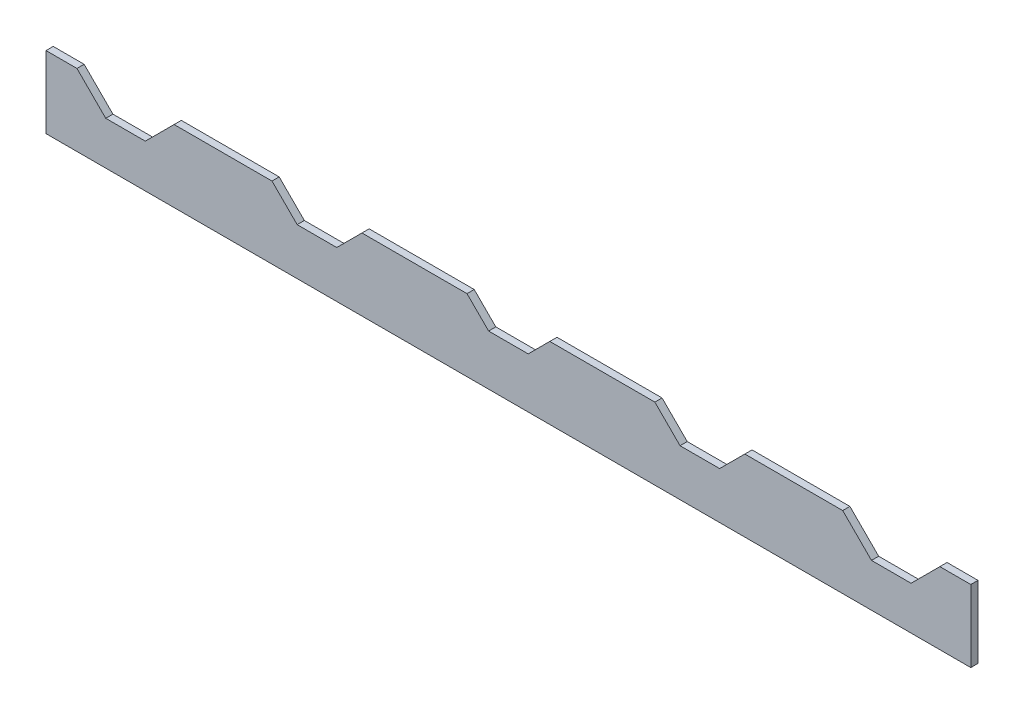
from build123d import *

# Parameters (mm, degrees)
SKETCH1_W             = 1285
SKETCH1_H             = 100
BOSS_EXTRUDE1_DEPTH   = 10
CUT_EXTRUDE1_REACH    = 652.312
SKETCH_PATTERN1_DEPTH = 10


# Read off the part's stored shape, not the designer's step: Sketch-Pattern1
with BuildPart() as part:
    # Sketch1 → Boss-Extrude1 (new body)
    with BuildSketch(Plane.XY):
        with Locations((0, 50)):
            Rectangle(SKETCH1_W, SKETCH1_H)
    extrude(amount=BOSS_EXTRUDE1_DEPTH)

    # Sketch2 → Cut-Extrude1 (cut, up to next)
    with BuildSketch(Plane.XY.offset(10), mode=Mode.PRIVATE) as cut_extrude1_sk1:
        Polygon((-82.5, 125), (-27.5, 70), (27.5, 70), (82.5, 125), align=None)
    cut_extrude1_tool1 = extrude(cut_extrude1_sk1.sketch, amount=-CUT_EXTRUDE1_REACH, mode=Mode.PRIVATE) & part.part
    add(cut_extrude1_tool1.solids().sort_by_distance((0, 102.083333, 10))[0], mode=Mode.SUBTRACT)

    # Sketch-Pattern1 outline → Sketch-Pattern1 (cut)
    with BuildSketch(Plane.XY):
        Polygon((-559.5, 60), (-504.5, 60), (-464.5, 100), (-599.5, 100), align=None)
        Polygon((-203.5, 100), (-328.5, 100), (-293.5, 65), (-238.5, 65), align=None)
    sketch_pattern1 = extrude(amount=SKETCH_PATTERN1_DEPTH, mode=Mode.SUBTRACT)

    # Mirror1: Sketch-Pattern1 across plane
    add(sketch_pattern1.mirror(Plane(origin=(0, 0, 0), x_dir=(0, 0, 1), z_dir=(1, 0, 0))), mode=Mode.SUBTRACT)


solid = part.part
